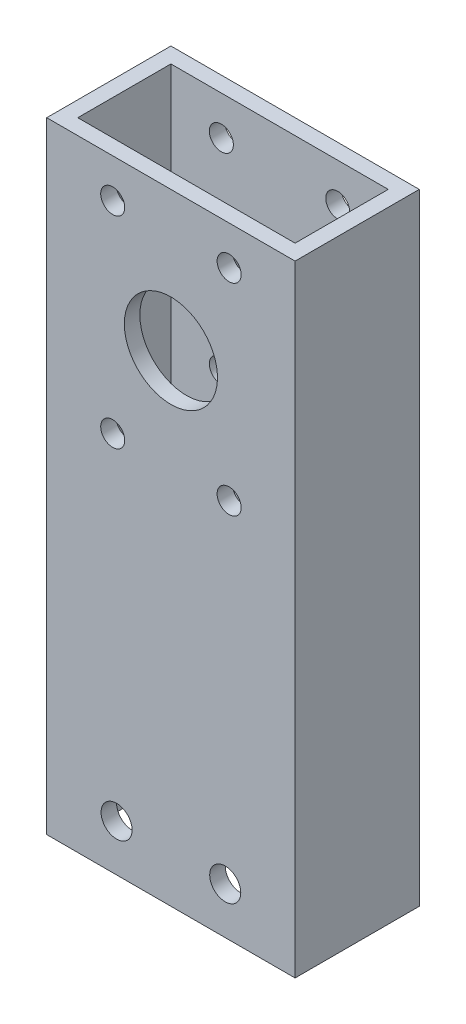
from build123d import *

# Parameters (mm, degrees)
SKETCH1_W                    = 50.8
SKETCH1_H                    = 25.4
SKETCH1_W_2                  = 44.45
SKETCH1_H_2                  = 19.05
EXTRUDE_THIN1_DEPTH          = 127
F_10_0_1935_DIAMETER_HOLE2_D = 4.9149
CUT_EXTRUDE2_DEPTH           = 132.982271537
CUT_EXTRUDE2_DEPTH_BACK      = 132.982271537
SKETCH7_R                    = 9.525
F_1_4_0_25_DIAMETER_HOLE1_D  = 6.35


with BuildPart() as part:
    # Sketch1 → Extrude-Thin1 (new body)
    with BuildSketch(Plane(origin=(0, 0, 0), x_dir=(1, 0, 0), z_dir=(0, 1, 0))):
        Rectangle(SKETCH1_W, SKETCH1_H)
        Rectangle(SKETCH1_W_2, SKETCH1_H_2, mode=Mode.SUBTRACT)
    extrude(amount=EXTRUDE_THIN1_DEPTH)

    # #10 (0.1935) Diameter Hole2 (through all)
    with Locations(Plane(origin=(0, 0, -12.7), x_dir=(-1, 0, 0), z_dir=(0, 0, -1))):
        with Locations((-11.90625, 77.802770072), (-11.90625, 119.047229928), (11.90625, 119.047229928), (11.90625, 77.802770072)):
            Hole(F_10_0_1935_DIAMETER_HOLE2_D / 2)

    # Sketch7 → Cut-Extrude2 (cut, two sides: drawn at the far end of the back side and taken through both)
    with BuildSketch(Plane(origin=(0, 0, -12.7), x_dir=(-1, 0, 0), z_dir=(0, 0, -1)).offset(-CUT_EXTRUDE2_DEPTH_BACK)):
        with Locations((0, 98.425)):
            Circle(SKETCH7_R)
    extrude(amount=CUT_EXTRUDE2_DEPTH + CUT_EXTRUDE2_DEPTH_BACK, mode=Mode.SUBTRACT)

    # 1/4 (0.25) Diameter Hole1 (through all)
    with Locations(Plane.XY.offset(12.7)):
        with Locations((-11.1125, 9.525), (11.1125, 9.525), (-109.171479686, 68.785430569)):
            Hole(F_1_4_0_25_DIAMETER_HOLE1_D / 2)


solid = part.part
